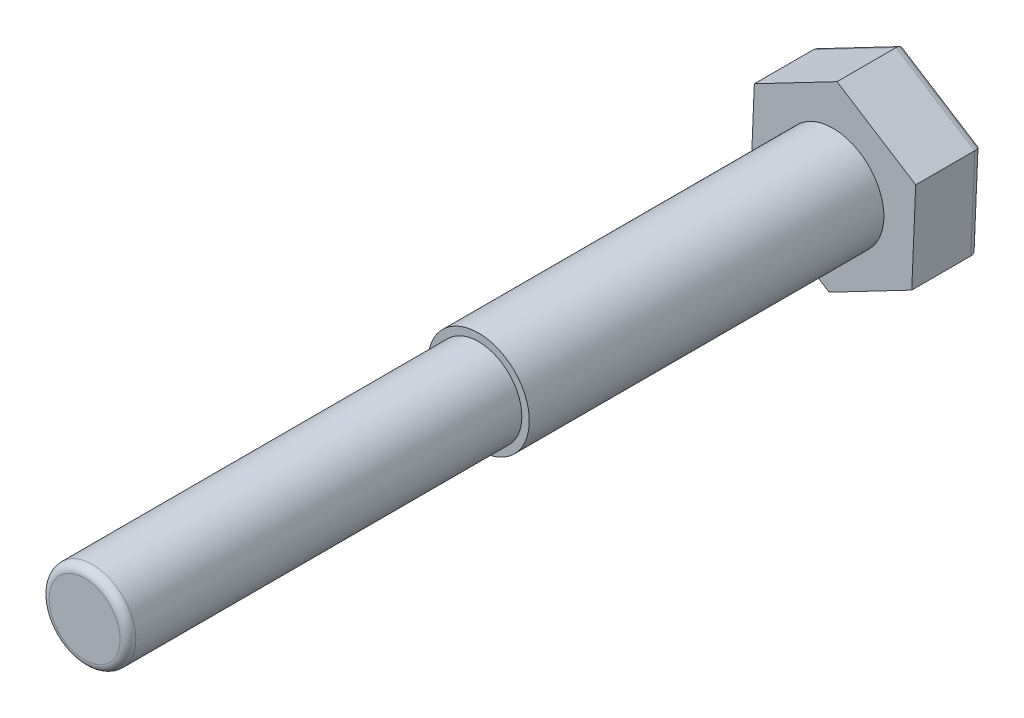
from build123d import *

# Parameters (mm, degrees)
EXTRUDE_372_DEPTH = 17
SKETCH_2_R        = 12.9
EXTRUDE_1_DEPTH   = 90
FILLET_3_R        = 2
SKETCH_3_R        = 11
EXTRUDE_2_DEPTH   = 100
FILLET_4_R        = 2


with BuildPart() as part:
    # 草图1 → Extrude 372 (new body)
    with BuildSketch(Plane.XY):
        Polygon((20.984201837, 10.954296262), (1.005402075, 23.65), (-19.978799762, 12.695703738), (-20.984201837, -10.954296262), (-1.005402075, -23.65), (19.978799762, -12.695703738), align=None)
    extrude(amount=EXTRUDE_372_DEPTH)

    # 草图2 → 凸台-拉伸1 (add)
    with BuildSketch(Plane.XY.offset(17)):
        Circle(SKETCH_2_R)
    extrude(amount=EXTRUDE_1_DEPTH)

    # 圆角3
    fillet_3_edges = [part.edges().sort_by_distance(p)[0] for p in [
        (10.994801956, 17.302148131, 0),
        (-9.486698843, 18.172851869, 0),
        (-20.4815008, 0.870703738, 0),
        (-10.994801956, -17.302148131, 0),
        (9.486698843, -18.172851869, 0),
        (20.4815008, -0.870703738, 0),
    ]]
    fillet(fillet_3_edges, radius=FILLET_3_R)

    # 草图3 → 凸台-拉伸2 (add)
    with BuildSketch(Plane.XY.offset(107)):
        Circle(SKETCH_3_R)
    extrude(amount=EXTRUDE_2_DEPTH)

    # 圆角4
    fillet_4_edges = [part.edges().sort_by_distance(p)[0] for p in [
        (-11, 0, 207),
    ]]
    fillet(fillet_4_edges, radius=FILLET_4_R)


solid = part.part
